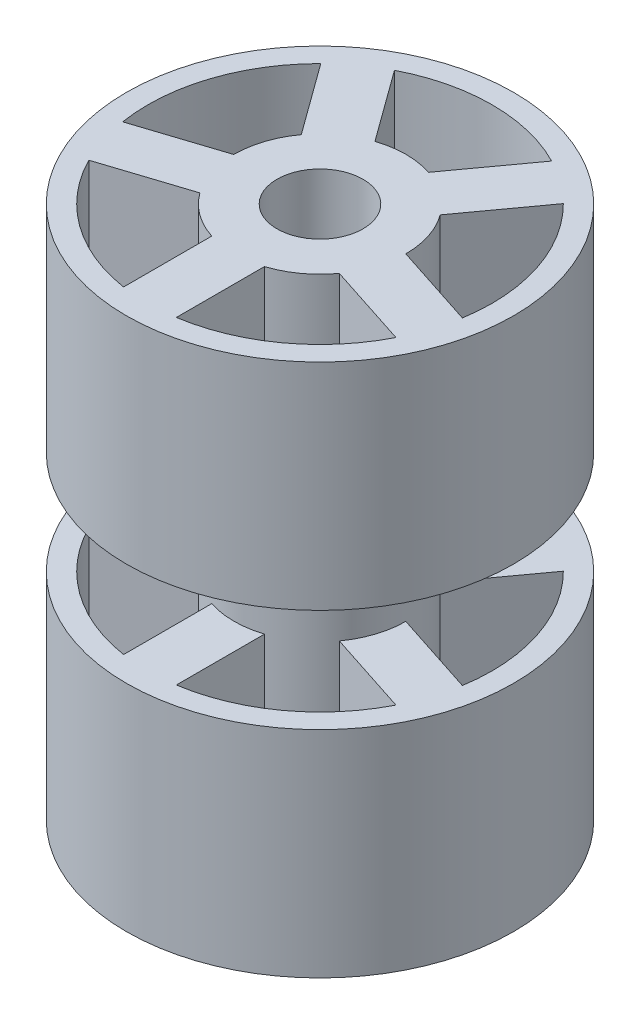
from build123d import *

# Parameters (mm, degrees)
SKETCH1_W           = 5
SKETCH1_H           = 62
SKETCH1_W_2         = 2.5
SKETCH1_H_2         = 25
SKETCH2_W           = 6.130760382
SKETCH2_H           = 11
BOSS_EXTRUDE1_DEPTH = 25
CIRPATTERN1_COUNT   = 5
SKETCH3_W           = 6.130760382
SKETCH3_H           = 12
BOSS_EXTRUDE2_DEPTH = 25
CIRPATTERN2_COUNT   = 5


with BuildPart() as part:
    # Sketch1 → Revolve1 (revolve)
    with BuildSketch(Plane(origin=(0, 0, 0), x_dir=(0, 0, -1), z_dir=(1, 0, 0))):
        with Locations((7.5, 31)):
            Rectangle(SKETCH1_W, SKETCH1_H)
        with Locations((21.25, 12.5)):
            Rectangle(SKETCH1_W_2, SKETCH1_H_2)
        with Locations((21.25, 49.5)):
            Rectangle(SKETCH1_W_2, SKETCH1_H_2)
    revolve(axis=Axis((0, 0, 0), (0, 1, 0)))

    # Sketch2 → Boss-Extrude1 (add)
    with BuildSketch(Plane.XZ):
        with Locations((0, 15.018584153)):
            Rectangle(SKETCH2_W, SKETCH2_H)
    boss_extrude1 = extrude(amount=-BOSS_EXTRUDE1_DEPTH)

    # CirPattern1: Boss-Extrude1 ×5 about axis
    cirpattern1_axis = Axis((0, 0, 0), (0, -1, 0))
    for i in range(1, CIRPATTERN1_COUNT):
        add(boss_extrude1.rotate(cirpattern1_axis, i * 360 / CIRPATTERN1_COUNT))

    # Sketch3 → Boss-Extrude2 (add)
    with BuildSketch(Plane(origin=(0, 62, 0), x_dir=(-1, 0, 0), z_dir=(0, 1, 0))):
        with Locations((0, 14.863932977)):
            Rectangle(SKETCH3_W, SKETCH3_H)
    boss_extrude2 = extrude(amount=-BOSS_EXTRUDE2_DEPTH)

    # CirPattern2: Boss-Extrude2 ×5 about axis
    cirpattern2_axis = Axis((0, 62, 0), (0, -1, 0))
    for i in range(1, CIRPATTERN2_COUNT):
        add(boss_extrude2.rotate(cirpattern2_axis, i * 360 / CIRPATTERN2_COUNT))


solid = part.part
